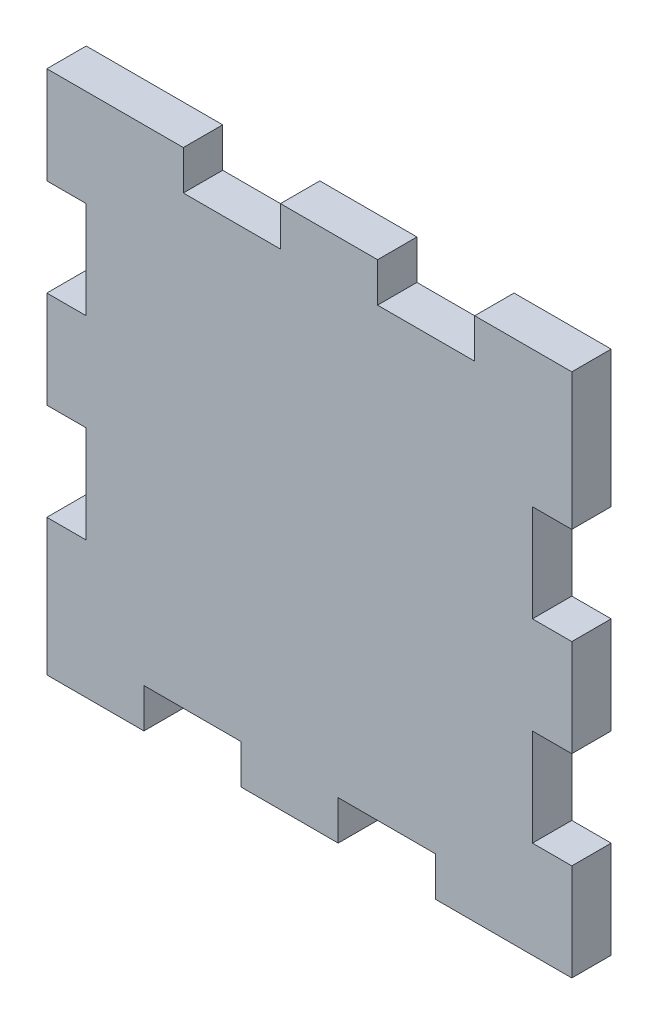
from build123d import *

# Parameters (mm, degrees)
SKETCH1_W           = 60
SKETCH1_H           = 60
BOSS_EXTRUDE1_DEPTH = 4.5
CAVITY1_OUTLINE_W   = 11.1
CAVITY1_OUTLINE_H   = 4.5
CAVITY1_DEPTH       = 4.5
CAVITY1_START       = 55.5
CAVITY1_2_OUTLINE_W = 11.1
CAVITY1_2_OUTLINE_H = 4.5
CAVITY1_2_DEPTH     = 4.5
CAVITY1_START_2     = 15.6
CAVITY1_3_OUTLINE_W = 4.5
CAVITY1_3_OUTLINE_H = 4.5
CAVITY1_3_DEPTH     = 6.6
CAVITY1_START_3     = 37.8
CAVITY1_4_OUTLINE_W = 4.5
CAVITY1_4_OUTLINE_H = 4.5
CAVITY1_4_DEPTH     = 6.6
CAVITY1_START_4     = 11.1
CAVITY1_5_OUTLINE_W = 4.5
CAVITY1_5_OUTLINE_H = 4.5
CAVITY1_5_DEPTH     = 4.5
CAVITY1_START_5     = 22.2
CAVITY1_6_OUTLINE_W = 4.5
CAVITY1_6_OUTLINE_H = 4.5
CAVITY1_6_DEPTH     = 4.5
CAVITY1_START_6     = 33.3
CAVITY1_7_OUTLINE_W = 4.5
CAVITY1_7_OUTLINE_H = 4.5
CAVITY1_7_DEPTH     = 4.5
CAVITY1_START_7     = 44.4
CAVITY1_8_OUTLINE_W = 4.5
CAVITY1_8_OUTLINE_H = 4.5
CAVITY1_8_DEPTH     = 4.5


# Read off the part's stored shape, not the designer's step: Cavity1
with BuildPart() as part:
    # Sketch1 → Boss-Extrude1 (new body)
    with BuildSketch(Plane.XY):
        with Locations((30, 30)):
            Rectangle(SKETCH1_W, SKETCH1_H)
    extrude(amount=BOSS_EXTRUDE1_DEPTH)

    # Cavity1 outline → Cavity1 (cut)
    with BuildSketch(Plane.YZ):
        with Locations((21.15, 2.25)):
            Rectangle(CAVITY1_OUTLINE_W, CAVITY1_OUTLINE_H)
        with Locations((43.35, 2.25)):
            Rectangle(CAVITY1_OUTLINE_W, CAVITY1_OUTLINE_H)
    extrude(amount=CAVITY1_DEPTH, mode=Mode.SUBTRACT)

    # Cavity1 2 outline → Cavity1 2 (cut)
    with BuildSketch(Plane.YZ.offset(CAVITY1_START)):
        with Locations((16.65, 2.25)):
            Rectangle(CAVITY1_2_OUTLINE_W, CAVITY1_2_OUTLINE_H)
        with Locations((38.85, 2.25)):
            Rectangle(CAVITY1_2_OUTLINE_W, CAVITY1_2_OUTLINE_H)
    extrude(amount=CAVITY1_2_DEPTH, mode=Mode.SUBTRACT)

    # Cavity1 3 outline → Cavity1 3 (cut)
    with BuildSketch(Plane.YZ.offset(CAVITY1_START_2)):
        with Locations((2.25, 2.25)):
            Rectangle(CAVITY1_3_OUTLINE_W, CAVITY1_3_OUTLINE_H)
        with Locations((57.75, 2.25)):
            Rectangle(CAVITY1_3_OUTLINE_W, CAVITY1_3_OUTLINE_H)
    extrude(amount=CAVITY1_3_DEPTH, mode=Mode.SUBTRACT)

    # Cavity1 4 outline → Cavity1 4 (cut)
    with BuildSketch(Plane.YZ.offset(CAVITY1_START_3)):
        with Locations((2.25, 2.25)):
            Rectangle(CAVITY1_4_OUTLINE_W, CAVITY1_4_OUTLINE_H)
        with Locations((57.75, 2.25)):
            Rectangle(CAVITY1_4_OUTLINE_W, CAVITY1_4_OUTLINE_H)
    extrude(amount=CAVITY1_4_DEPTH, mode=Mode.SUBTRACT)

    # Cavity1 5 outline → Cavity1 5 (cut)
    with BuildSketch(Plane.YZ.offset(CAVITY1_START_4)):
        with Locations((2.25, 2.25)):
            Rectangle(CAVITY1_5_OUTLINE_W, CAVITY1_5_OUTLINE_H)
    extrude(amount=CAVITY1_5_DEPTH, mode=Mode.SUBTRACT)

    # Cavity1 6 outline → Cavity1 6 (cut)
    with BuildSketch(Plane.YZ.offset(CAVITY1_START_5)):
        with Locations((57.75, 2.25)):
            Rectangle(CAVITY1_6_OUTLINE_W, CAVITY1_6_OUTLINE_H)
    extrude(amount=CAVITY1_6_DEPTH, mode=Mode.SUBTRACT)

    # Cavity1 7 outline → Cavity1 7 (cut)
    with BuildSketch(Plane.YZ.offset(CAVITY1_START_6)):
        with Locations((2.25, 2.25)):
            Rectangle(CAVITY1_7_OUTLINE_W, CAVITY1_7_OUTLINE_H)
    extrude(amount=CAVITY1_7_DEPTH, mode=Mode.SUBTRACT)

    # Cavity1 8 outline → Cavity1 8 (cut)
    with BuildSketch(Plane.YZ.offset(CAVITY1_START_7)):
        with Locations((57.75, 2.25)):
            Rectangle(CAVITY1_8_OUTLINE_W, CAVITY1_8_OUTLINE_H)
    extrude(amount=CAVITY1_8_DEPTH, mode=Mode.SUBTRACT)


solid = part.part
